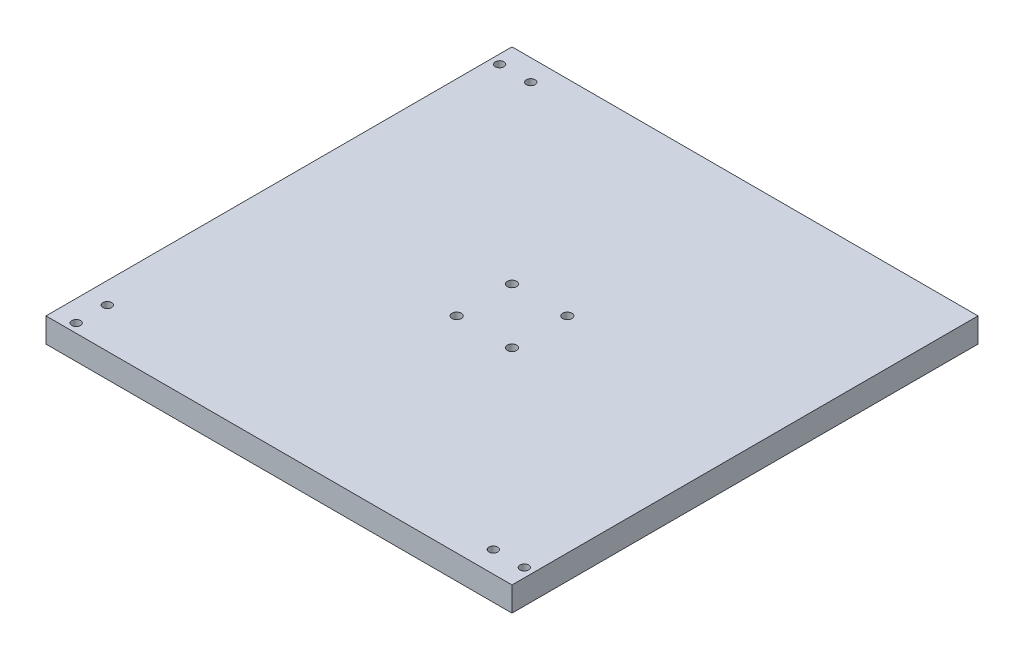
from build123d import *

# Parameters (mm, degrees)
SKETCH1_W           = 190.5
SKETCH1_H           = 190.5
SKETCH1_R           = 1.905
SKETCH1_R_2         = 1.778
BOSS_EXTRUDE1_DEPTH = 10


with BuildPart() as part:
    # Sketch1 → Boss-Extrude1 (new body)
    with BuildSketch(Plane(origin=(0, 0, 0), x_dir=(1, 0, 0), z_dir=(0, 1, 0))):
        Rectangle(SKETCH1_W, SKETCH1_H)
        with Locations((-11.303, 11.303)):
            Circle(SKETCH1_R, mode=Mode.SUBTRACT)
        with Locations((-11.303, -11.303)):
            Circle(SKETCH1_R, mode=Mode.SUBTRACT)
        with Locations((11.303, 11.303)):
            Circle(SKETCH1_R, mode=Mode.SUBTRACT)
        with Locations((11.303, -11.303)):
            Circle(SKETCH1_R, mode=Mode.SUBTRACT)
        with Locations((-78.9, 86.55)):
            Circle(SKETCH1_R_2, mode=Mode.SUBTRACT)
        with Locations((-91.6, 86.55)):
            Circle(SKETCH1_R_2, mode=Mode.SUBTRACT)
        with Locations((91.6, -86.55)):
            Circle(SKETCH1_R_2, mode=Mode.SUBTRACT)
        with Locations((78.9, -86.55)):
            Circle(SKETCH1_R_2, mode=Mode.SUBTRACT)
        with Locations((-86.55, -78.9)):
            Circle(SKETCH1_R_2, mode=Mode.SUBTRACT)
        with Locations((-86.55, -91.6)):
            Circle(SKETCH1_R_2, mode=Mode.SUBTRACT)
    extrude(amount=BOSS_EXTRUDE1_DEPTH)


solid = part.part
